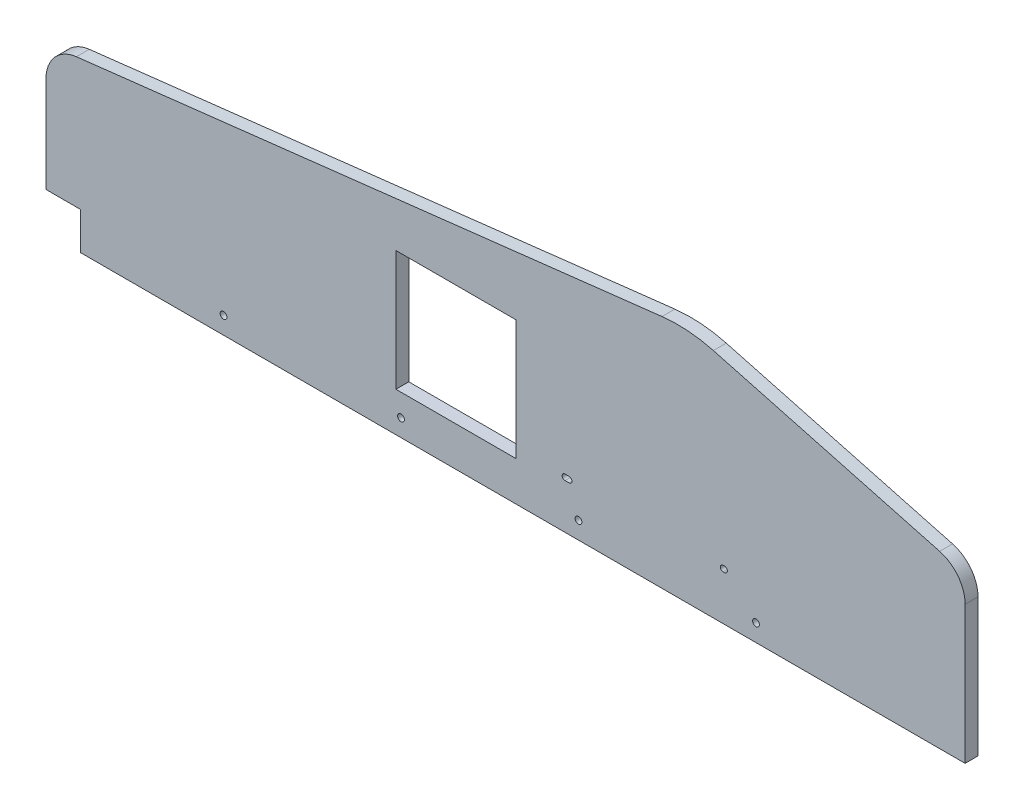
from build123d import *

# Parameters (mm, degrees)
BOSS_EXTRUDE1_DEPTH         = 4.7625
FILLET1_R                   = 25.4
FILLET2_R                   = 101.6
SKETCH3_W                   = 25.4
SKETCH3_H                   = 27.686
CUT_EXTRUDE1_DEPTH          = 383.440406717
SKETCH5_W                   = 88.9
SKETCH5_H                   = 88.9
CUT_EXTRUDE2_DEPTH          = 383.440406717
TAP_DRILL_FOR_M6X1_0_TAP1_D = 5
CUT_EXTRUDE3_DEPTH          = 383.440406717


with BuildPart() as part:
    # Sketch2 → Boss-Extrude1 (new, symmetric)
    with BuildSketch(Plane.XY):
        Polygon((-340, 26.400000032), (-340, 121.400000032), (135, 176.400000032), (340, 121.400000032), (340, 26.400000032), (340, 0), (-340, 0), align=None)
    extrude(amount=BOSS_EXTRUDE1_DEPTH, both=True)

    # Fillet1
    fillet1_edges = [part.edges().sort_by_distance(p)[0] for p in [
        (340, 121.400000032, 0),
        (-340, 121.400000032, 0),
    ]]
    fillet(fillet1_edges, radius=FILLET1_R)

    # Fillet2
    fillet2_edges = [part.edges().sort_by_distance(p)[0] for p in [
        (135, 176.400000032, 0),
    ]]
    fillet(fillet2_edges, radius=FILLET2_R)

    # Sketch3 → Cut-Extrude1 (cut, through all)
    with BuildSketch(Plane.XY.offset(4.7625)):
        with Locations((-327.3, 13.843)):
            Rectangle(SKETCH3_W, SKETCH3_H)
    extrude(amount=-CUT_EXTRUDE1_DEPTH, mode=Mode.SUBTRACT)

    # Sketch5 → Cut-Extrude2 (cut, through all)
    with BuildSketch(Plane.XY.offset(4.7625)):
        with Locations((-36.66848567, 73.596499999)):
            Rectangle(SKETCH5_W, SKETCH5_H)
    extrude(amount=-CUT_EXTRUDE2_DEPTH, mode=Mode.SUBTRACT)

    # Tap Drill for M6x1.0 Tap1 (through all)
    with Locations(Plane.XY.offset(4.7625)):
        with Locations((-208.682, 12.7), (-77.364, 12.7), (53.954, 12.7), (185.272, 12.7)):
            Hole(TAP_DRILL_FOR_M6X1_0_TAP1_D / 2)

    # Sketch8 → Cut-Extrude3 (cut, through all)
    with BuildSketch(Plane.XY.offset(4.7625)):
        with BuildLine():
            Line((161, 37.4), (162, 37.4))
            ThreePointArc((162, 37.4), (164.1, 35.3), (162, 33.2))
            Line((162, 33.2), (161, 33.2))
            ThreePointArc((161, 33.2), (158.9, 35.3), (161, 37.4))
        make_face()
        with BuildLine():
            Line((47, 33.2), (44, 33.2))
            ThreePointArc((44, 33.2), (41.9, 35.3), (44, 37.4))
            Line((44, 37.4), (47, 37.4))
            ThreePointArc((47, 37.4), (49.1, 35.3), (47, 33.2))
        make_face()
    extrude(amount=-CUT_EXTRUDE3_DEPTH, mode=Mode.SUBTRACT)


solid = part.part
